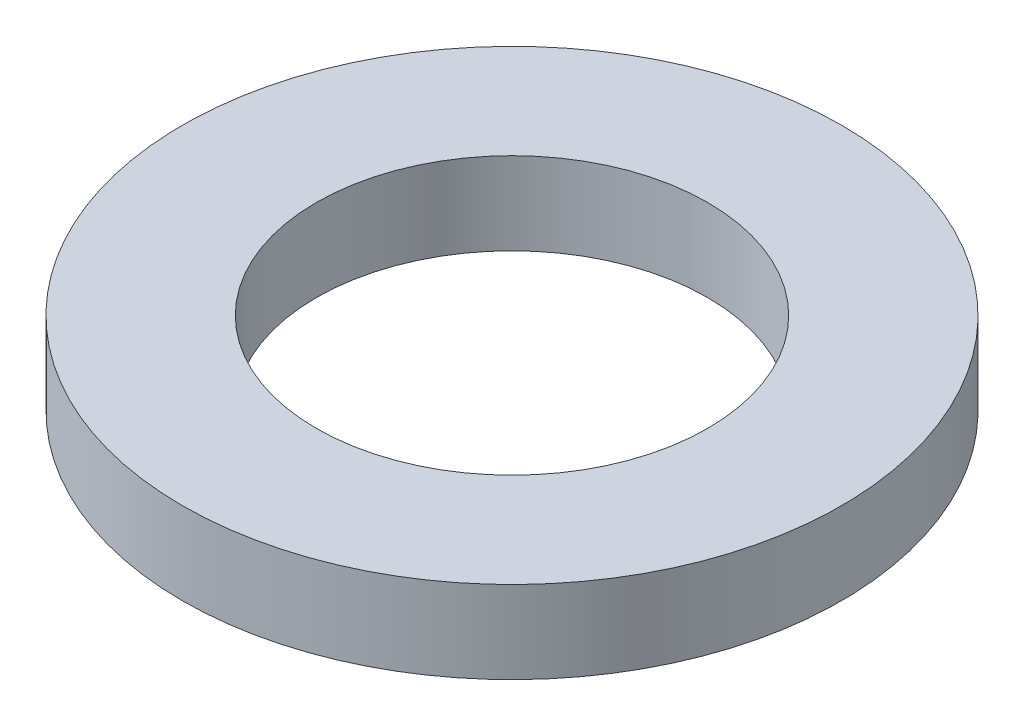
from build123d import *

# Parameters (mm, degrees)
SKETCH1_R           = 80
BOSS_EXTRUDE1_DEPTH = 20
SKETCH2_R           = 47.5
CUT_EXTRUDE1_DEPTH  = 115.891252931


with BuildPart() as part:
    # Sketch1 → Boss-Extrude1 (new body)
    with BuildSketch(Plane(origin=(0, 0, 0), x_dir=(1, 0, 0), z_dir=(0, 1, 0))):
        Circle(SKETCH1_R)
    extrude(amount=BOSS_EXTRUDE1_DEPTH)

    # Sketch2 → Cut-Extrude1 (cut, through all)
    with BuildSketch(Plane(origin=(0, 0, 0), x_dir=(1, 0, 0), z_dir=(0, 1, 0))):
        Circle(SKETCH2_R)
    extrude(amount=CUT_EXTRUDE1_DEPTH, mode=Mode.SUBTRACT)


solid = part.part
